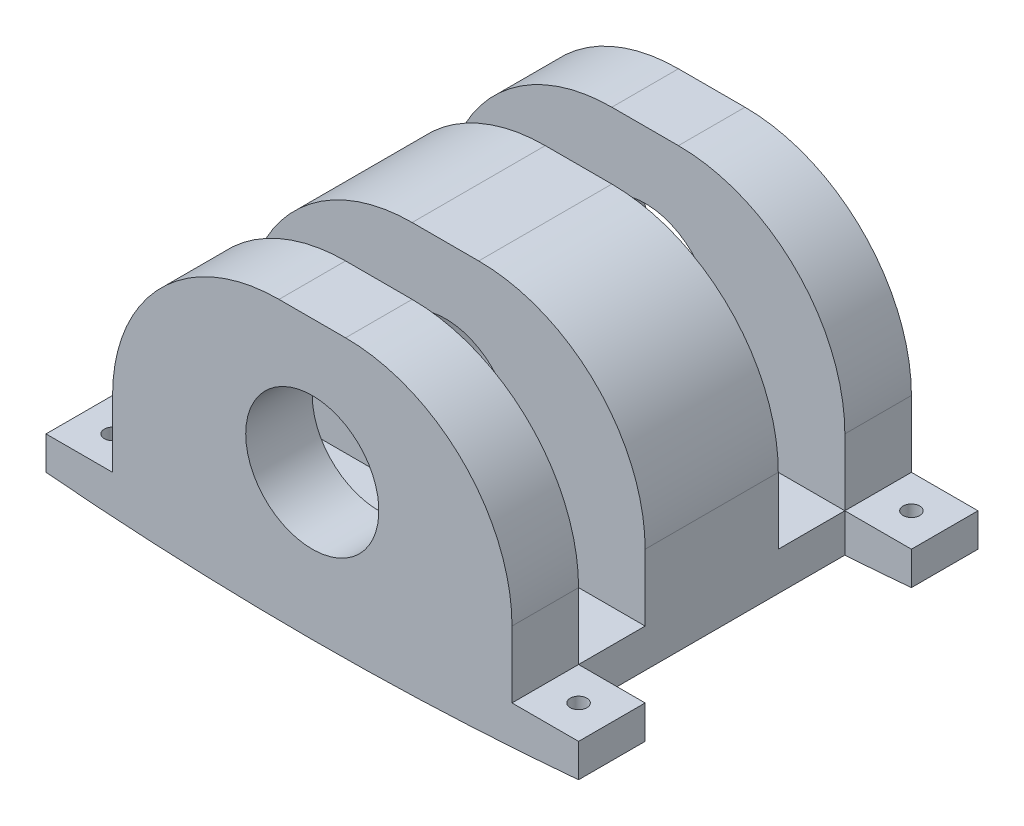
from build123d import *

# Parameters (mm, degrees)
SKETCH1_R                   = 25.4
BOSS_EXTRUDE1_DEPTH         = 152.4
CUT_EXTRUDE1_DEPTH          = 192.327109702
CUT_EXTRUDE1_DEPTH_BACK     = 192.327109702
SKETCH3_W                   = 25.4
SKETCH3_H                   = 88.9
F_1_4_0_25_DIAMETER_HOLE1_D = 6.35
SKETCH4_W                   = 25.4
SKETCH4_H                   = 101.6
CUT_EXTRUDE2_DEPTH          = 204.596488307


with BuildPart() as part:
    # Sketch1 → Boss-Extrude1 (new body)
    with BuildSketch(Plane.XY):
        with BuildLine():
            Line((-76.2, -38.1), (-76.2, -12.7))
            ThreePointArc((-76.2, -12.7), (-57.601280605, 32.201280605), (-12.7, 50.8))
            Line((-12.7, 50.8), (12.7, 50.8))
            ThreePointArc((12.7, 50.8), (57.601280605, 32.201280605), (76.2, -12.7))
            Line((76.2, -12.7), (76.2, -38.1))
            Line((76.2, -38.1), (101.6, -38.1))
            Line((101.6, -38.1), (101.6, -50.8))
            ThreePointArc((101.6, -50.8), (0, -55.296861637), (-101.6, -50.8))
            Line((-101.6, -50.8), (-101.6, -38.1))
            Line((-101.6, -38.1), (-76.2, -38.1))
        make_face()
        Circle(SKETCH1_R, mode=Mode.SUBTRACT)
    extrude(amount=BOSS_EXTRUDE1_DEPTH)

    # Sketch3 → Cut-Extrude1 (cut, two sides: drawn at the far end of the back side and taken through both)
    with BuildSketch(Plane(origin=(0, 0, 0), x_dir=(0, 0, -1), z_dir=(1, 0, 0)).offset(-CUT_EXTRUDE1_DEPTH_BACK)):
        with Locations((-114.3, 6.35)):
            Rectangle(SKETCH3_W, SKETCH3_H)
        with Locations((-38.1, 6.35)):
            Rectangle(SKETCH3_W, SKETCH3_H)
    extrude(amount=CUT_EXTRUDE1_DEPTH + CUT_EXTRUDE1_DEPTH_BACK, mode=Mode.SUBTRACT)

    # 1/4 (0.25) Diameter Hole1 (through all)
    with Locations(Plane(origin=(0, -38.1, 0), x_dir=(1, 0, 0), z_dir=(0, 1, 0))):
        with Locations((-88.9, -12.7), (-88.9, -139.7), (88.9, -12.7), (88.9, -139.7)):
            Hole(F_1_4_0_25_DIAMETER_HOLE1_D / 2)

    # Sketch4 → Cut-Extrude2 (cut, through all)
    with BuildSketch(Plane(origin=(0, -38.1, 0), x_dir=(1, 0, 0), z_dir=(0, 1, 0))):
        with Locations((-88.9, -76.2)):
            Rectangle(SKETCH4_W, SKETCH4_H)
        with Locations((88.9, -76.2)):
            Rectangle(SKETCH4_W, SKETCH4_H)
    extrude(amount=-CUT_EXTRUDE2_DEPTH, mode=Mode.SUBTRACT)


solid = part.part
